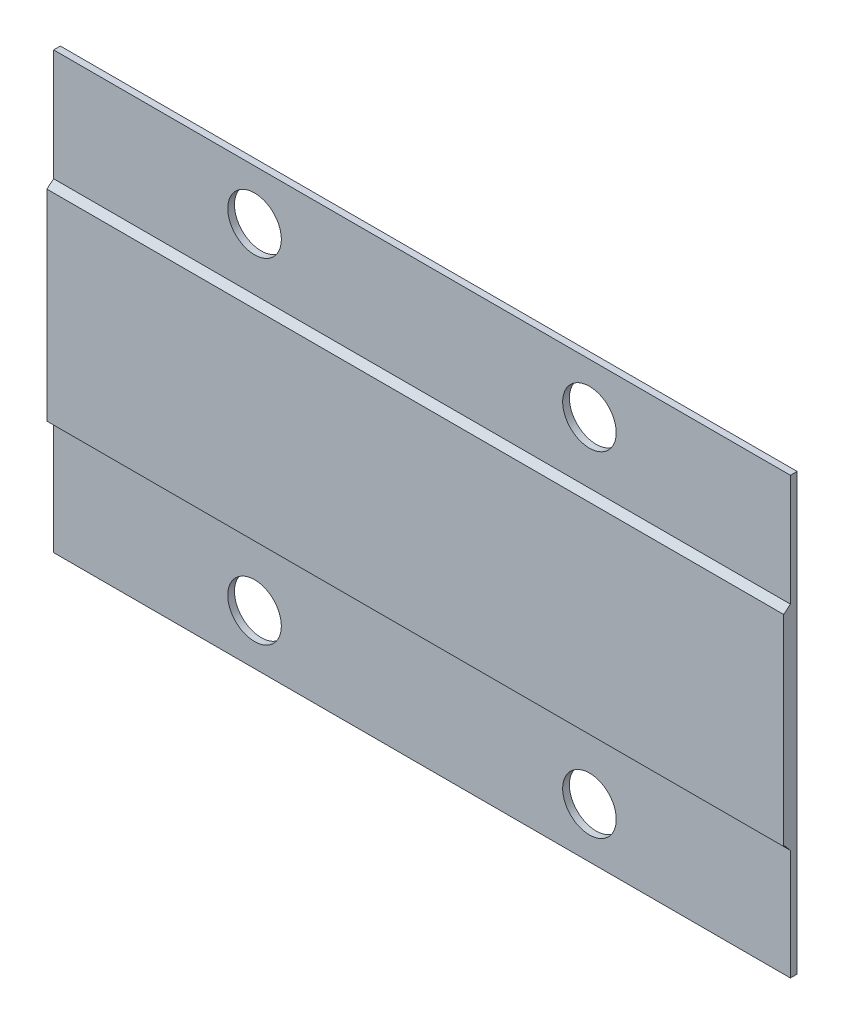
from build123d import *
from OCP.BRepFilletAPI import BRepFilletAPI_MakeChamfer

# Parameters (mm, degrees)
SKETCH1_W           = 44
SKETCH1_H           = 26
SKETCH1_R           = 1.6
BOSS_EXTRUDE1_DEPTH = 0.4
SKETCH2_W           = 44
SKETCH2_H           = 12
BOSS_EXTRUDE2_DEPTH = 0.4
CHAMFER1_SIZE       = 0.4
CHAMFER1_SIZE_2     = 0.335639852


with BuildPart() as part:
    # Sketch1 → Boss-Extrude1 (new body)
    with BuildSketch(Plane.XY):
        with Locations((22, 13)):
            Rectangle(SKETCH1_W, SKETCH1_H)
        with Locations((32, 3)):
            Circle(SKETCH1_R, mode=Mode.SUBTRACT)
        with Locations((12, 3)):
            Circle(SKETCH1_R, mode=Mode.SUBTRACT)
        with Locations((32, 23)):
            Circle(SKETCH1_R, mode=Mode.SUBTRACT)
        with Locations((12, 23)):
            Circle(SKETCH1_R, mode=Mode.SUBTRACT)
    extrude(amount=BOSS_EXTRUDE1_DEPTH)

    # Sketch2 → Boss-Extrude2 (add)
    with BuildSketch(Plane.XY.offset(0.4)):
        with Locations((22, 13)):
            Rectangle(SKETCH2_W, SKETCH2_H)
    extrude(amount=BOSS_EXTRUDE2_DEPTH)

    # Chamfer1
    chamfer1_edges_1 = [part.edges().sort_by_distance(p)[0] for p in [
        (22, 7, 0.4),
    ]]
    chamfer1_side_1 = [part.faces().sort_by_distance(p)[0] for p in [
        (22, 6.993287203, 0.4),
    ]]
    chamfer1_edges_2 = [part.edges().sort_by_distance(p)[0] for p in [
        (22, 19, 0.4),
    ]]
    chamfer1_side_2 = [part.faces().sort_by_distance(p)[0] for p in [
        (22, 19.006712797, 0.4),
    ]]
    chamfer1 = BRepFilletAPI_MakeChamfer(part.part.solid().wrapped)
    for e in chamfer1_edges_1:
        chamfer1.Add(CHAMFER1_SIZE - 0.0001, CHAMFER1_SIZE_2 - 0.0001, e.wrapped, chamfer1_side_1[0].wrapped)
    for e in chamfer1_edges_2:
        chamfer1.Add(CHAMFER1_SIZE_2 - 0.0001, CHAMFER1_SIZE - 0.0001, e.wrapped, chamfer1_side_2[0].wrapped)
    add(Compound.cast(chamfer1.Shape()), mode=Mode.REPLACE)  # a hair under: the kernel refuses the full size


solid = part.part
